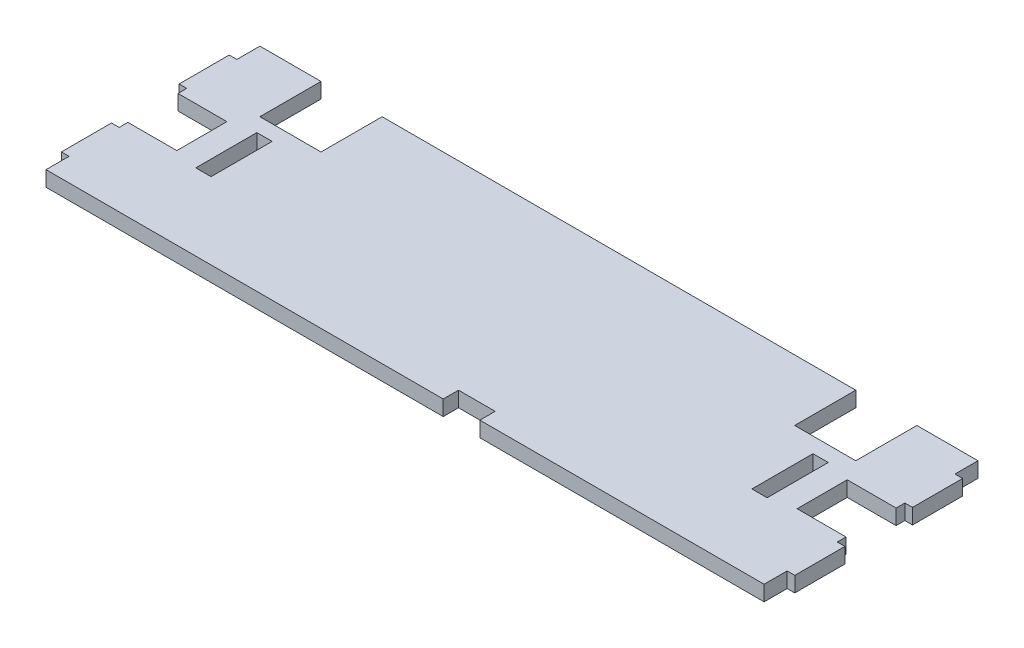
from build123d import *

# Parameters (mm, degrees)
BOSS_EXTRUDE1_DEPTH     = 3.175
CUT_EXTRUDE1_DEPTH      = 159.781746826
CUT_EXTRUDE1_DEPTH_BACK = 159.781746826
SKETCH2_W               = 6.35
SKETCH2_H               = 25.4


with BuildPart() as part:
    # Sketch1 → Boss-Extrude1 (new, symmetric)
    with BuildSketch(Plane(origin=(0, 0, 0), x_dir=(1, 0, 0), z_dir=(0, 1, 0))):
        Polygon((149.225, -44.45), (31.115, -44.45), (31.115, -38.1), (15.875, -38.1), (15.875, -44.45), (-149.225, -44.45), (-149.225, -34.874677354), (-152.4, -34.874677354), (-152.4, -14.046677354), (-149.225, -14.046677354), (-149.225, -10.414), (-128.905, -10.414), (-128.905, 10.414), (-149.225, 10.414), (-149.225, 14.046677354), (-152.4, 14.046677354), (-152.4, 34.874677354), (-149.225, 34.874677354), (-149.225, 44.45), (-123.825, 44.45), (-123.825, 19.05), (-98.425, 19.05), (-98.425, 44.45), (98.425, 44.45), (98.425, 19.05), (123.825, 19.05), (123.825, 44.45), (149.225, 44.45), (149.225, 34.874677354), (152.4, 34.874677354), (152.4, 14.046677354), (149.225, 14.046677354), (149.225, 10.414), (128.905, 10.414), (128.905, -10.414), (149.225, -10.414), (149.225, -14.046677354), (152.4, -14.046677354), (152.4, -34.874677354), (149.225, -34.874677354), align=None)
    extrude(amount=BOSS_EXTRUDE1_DEPTH, both=True)

    # Sketch2 → Cut-Extrude1 (cut, two sides: drawn at the far end of the back side and taken through both)
    with BuildSketch(Plane(origin=(0, 0, 0), x_dir=(1, 0, 0), z_dir=(0, 1, 0)).offset(-CUT_EXTRUDE1_DEPTH_BACK)):
        with Locations((115.57, 0)):
            Rectangle(SKETCH2_W, SKETCH2_H)
        with Locations((-115.57, 0)):
            Rectangle(SKETCH2_W, SKETCH2_H)
    extrude(amount=CUT_EXTRUDE1_DEPTH + CUT_EXTRUDE1_DEPTH_BACK, mode=Mode.SUBTRACT)


solid = part.part
